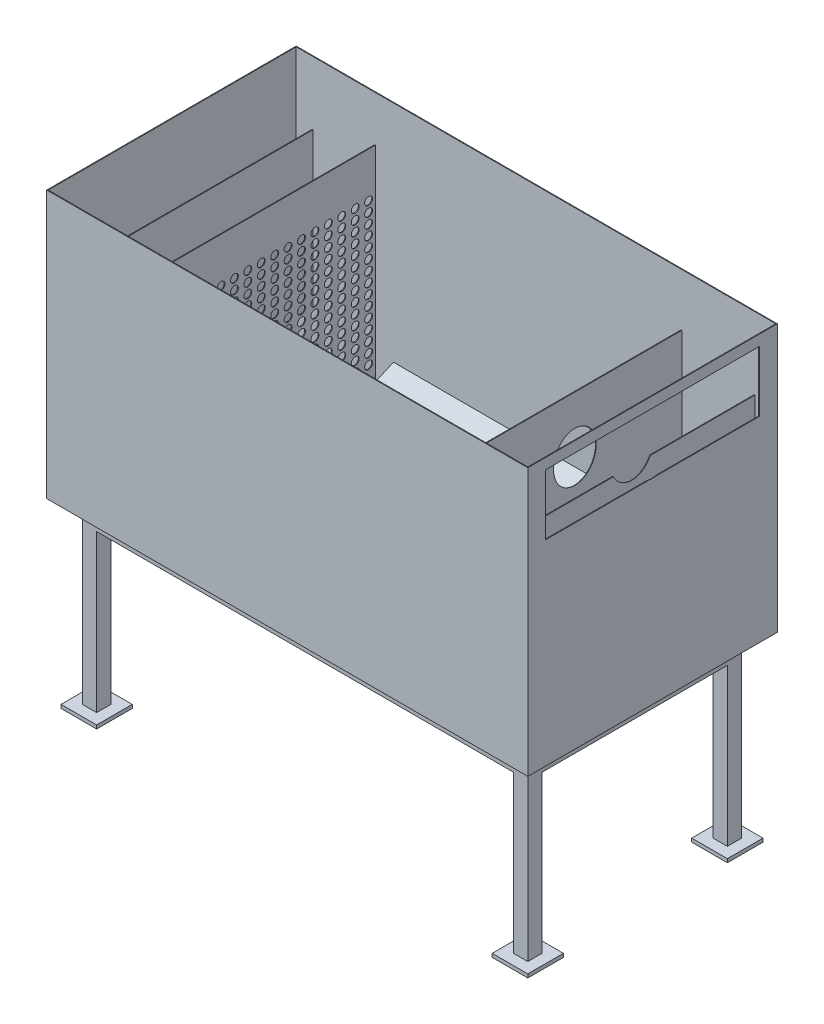
from build123d import *

# Parameters (mm, degrees)
MASTER_FOOTPRINT_W                  = 1350
MASTER_FOOTPRINT_H                  = 700
BATH_BASE_PLATE_DEPTH               = 750
BATH_SHELL_2MM_T                    = -2
SKETCH_1_R                          = 50
INLET_D100_OPENING_DEPTH            = 10
INLET_IMPACT_BAFFLE_START           = 125
SKETCH_2_W                          = 540
SKETCH_2_H                          = 430
INLET_IMPACT_BAFFLE_DEPTH           = 2
DISTRIBUTOR_D22_START               = 250
SKETCH_3_W                          = 640
SKETCH_3_H                          = 648
SKETCH_3_R                          = 11
DISTRIBUTOR_D22_DEPTH               = 2
OUTLET_SUBMERGED_BAFFLE_START       = 1130
SKETCH_4_W                          = 600
SKETCH_4_H                          = 330
OUTLET_SUBMERGED_BAFFLE_DEPTH       = 2
OVERFLOW_WEIR_Z550_START            = 1290
SKETCH_5_W                          = 690
SKETCH_5_H                          = 548
OVERFLOW_WEIR_Z550_DEPTH            = 2
OUTLET_WEIR_SLOT_W600_START         = 1345
SKETCH_6_W                          = 600
SKETCH_6_H                          = 170
OUTLET_WEIR_SLOT_W600_DEPTH         = 10
SLOPED_SEDIMENT_FLOOR_START         = 275
SLOPED_SEDIMENT_FLOOR_DEPTH         = 825
SKETCH_8_W                          = 40
SKETCH_8_H                          = 40
FRAME_LEGS_40X40_H500_DEPTH         = 500
FRAME_LONGITUDINAL_RAILS_START      = -20
SKETCH_9_W                          = 1250
SKETCH_9_H                          = 40
FRAME_LONGITUDINAL_RAILS_DEPTH      = 40
FRAME_TRANSVERSE_RAILS_START        = -20
SKETCH_10_W                         = 40
SKETCH_10_H                         = 520
FRAME_TRANSVERSE_RAILS_DEPTH        = 40
FRAME_FOOT_PADS_100X100_START       = -500
SKETCH_11_W                         = 100
SKETCH_11_H                         = 100
FRAME_FOOT_PADS_100X100_DEPTH       = 10
SEALED_SCREW_PASSAGE_D120_PROFILE_R = 60


with BuildPart() as part:
    # MASTER_FOOTPRINT → BATH_BASE_PLATE (new body)
    with BuildSketch(Plane(origin=(0, 0, 0), x_dir=(1, 0, 0), z_dir=(0, 1, 0))):
        with Locations((675, 350)):
            Rectangle(MASTER_FOOTPRINT_W, MASTER_FOOTPRINT_H)
    extrude(amount=BATH_BASE_PLATE_DEPTH)

    # BATH_SHELL_2MM
    bath_shell_2mm_openings = [part.faces().sort_by_distance(p)[0] for p in [
        (675, 750, -350),
    ]]
    offset(amount=BATH_SHELL_2MM_T, openings=bath_shell_2mm_openings, kind=Kind.INTERSECTION)

    # Эскиз1 → INLET_D100_OPENING (cut)
    with BuildSketch(Plane(origin=(0, 0, 0), x_dir=(0, 0, -1), z_dir=(1, 0, 0))):
        with Locations((350, 420)):
            Circle(SKETCH_1_R)
    extrude(amount=INLET_D100_OPENING_DEPTH, mode=Mode.SUBTRACT)

    # Эскиз6 → OUTLET_WEIR_SLOT_W600 (cut)
    with BuildSketch(Plane(origin=(0, 0, 0), x_dir=(0, 0, -1), z_dir=(1, 0, 0)).offset(OUTLET_WEIR_SLOT_W600_START)):
        with Locations((350, 635)):
            Rectangle(SKETCH_6_W, SKETCH_6_H)
    extrude(amount=OUTLET_WEIR_SLOT_W600_DEPTH, mode=Mode.SUBTRACT)

    # Эскиз7 → SLOPED_SEDIMENT_FLOOR (add)
    with BuildSketch(Plane(origin=(0, 0, 0), x_dir=(0, 0, -1), z_dir=(1, 0, 0)).offset(SLOPED_SEDIMENT_FLOOR_START)):
        Polygon((2, -1), (2, 120), (280, -1), align=None)
        Polygon((698, -1), (698, 120), (420, -1), align=None)
    extrude(amount=SLOPED_SEDIMENT_FLOOR_DEPTH)

    # Эскиз8 → FRAME_LEGS_40X40_H500 (add)
    with BuildSketch(Plane(origin=(0, 0, 0), x_dir=(1, 0, 0), z_dir=(0, 1, 0))):
        with Locations((70, 70)):
            Rectangle(SKETCH_8_W, SKETCH_8_H)
        with Locations((70, 630)):
            Rectangle(SKETCH_8_W, SKETCH_8_H)
        with Locations((1280, 70)):
            Rectangle(SKETCH_8_W, SKETCH_8_H)
        with Locations((1280, 630)):
            Rectangle(SKETCH_8_W, SKETCH_8_H)
    extrude(amount=-FRAME_LEGS_40X40_H500_DEPTH)

    # Эскиз9 → FRAME_LONGITUDINAL_RAILS (add)
    with BuildSketch(Plane(origin=(0, 0, 0), x_dir=(1, 0, 0), z_dir=(0, 1, 0)).offset(FRAME_LONGITUDINAL_RAILS_START)):
        with Locations((675, 70)):
            Rectangle(SKETCH_9_W, SKETCH_9_H)
        with Locations((675, 630)):
            Rectangle(SKETCH_9_W, SKETCH_9_H)
    extrude(amount=-FRAME_LONGITUDINAL_RAILS_DEPTH)

    # Эскиз10 → FRAME_TRANSVERSE_RAILS (add)
    with BuildSketch(Plane(origin=(0, 0, 0), x_dir=(1, 0, 0), z_dir=(0, 1, 0)).offset(FRAME_TRANSVERSE_RAILS_START)):
        with Locations((70, 350)):
            Rectangle(SKETCH_10_W, SKETCH_10_H)
        with Locations((1280, 350)):
            Rectangle(SKETCH_10_W, SKETCH_10_H)
    extrude(amount=-FRAME_TRANSVERSE_RAILS_DEPTH)

    # Эскиз11 → FRAME_FOOT_PADS_100X100 (add)
    with BuildSketch(Plane(origin=(0, 0, 0), x_dir=(1, 0, 0), z_dir=(0, 1, 0)).offset(FRAME_FOOT_PADS_100X100_START)):
        with Locations((70, 70)):
            Rectangle(SKETCH_11_W, SKETCH_11_H)
        with Locations((70, 630)):
            Rectangle(SKETCH_11_W, SKETCH_11_H)
        with Locations((1280, 70)):
            Rectangle(SKETCH_11_W, SKETCH_11_H)
        with Locations((1280, 630)):
            Rectangle(SKETCH_11_W, SKETCH_11_H)
    extrude(amount=-FRAME_FOOT_PADS_100X100_DEPTH)


with BuildPart() as body_2:
    # Эскиз2 → INLET_IMPACT_BAFFLE (new body)
    with BuildSketch(Plane(origin=(0, 0, 0), x_dir=(0, 0, -1), z_dir=(1, 0, 0)).offset(INLET_IMPACT_BAFFLE_START)):
        with Locations((350, 435)):
            Rectangle(SKETCH_2_W, SKETCH_2_H)
    extrude(amount=INLET_IMPACT_BAFFLE_DEPTH)


with BuildPart() as body_3:
    # Эскиз3 → DISTRIBUTOR_D22 (new body)
    with BuildSketch(Plane(origin=(0, 0, 0), x_dir=(0, 0, -1), z_dir=(1, 0, 0)).offset(DISTRIBUTOR_D22_START)):
        with Locations((350, 326)):
            Rectangle(SKETCH_3_W, SKETCH_3_H)
        with Locations((48.823529412, 125)):
            Circle(SKETCH_3_R, mode=Mode.SUBTRACT)
        with Locations((48.823529412, 153.5)):
            Circle(SKETCH_3_R, mode=Mode.SUBTRACT)
        with Locations((48.823529412, 182)):
            Circle(SKETCH_3_R, mode=Mode.SUBTRACT)
        with Locations((48.823529412, 210.5)):
            Circle(SKETCH_3_R, mode=Mode.SUBTRACT)
        with Locations((48.823529412, 239)):
            Circle(SKETCH_3_R, mode=Mode.SUBTRACT)
        with Locations((48.823529412, 267.5)):
            Circle(SKETCH_3_R, mode=Mode.SUBTRACT)
        with Locations((48.823529412, 296)):
            Circle(SKETCH_3_R, mode=Mode.SUBTRACT)
        with Locations((48.823529412, 324.5)):
            Circle(SKETCH_3_R, mode=Mode.SUBTRACT)
        with Locations((48.823529412, 353)):
            Circle(SKETCH_3_R, mode=Mode.SUBTRACT)
        with Locations((48.823529412, 381.5)):
            Circle(SKETCH_3_R, mode=Mode.SUBTRACT)
        with Locations((48.823529412, 410)):
            Circle(SKETCH_3_R, mode=Mode.SUBTRACT)
        with Locations((48.823529412, 438.5)):
            Circle(SKETCH_3_R, mode=Mode.SUBTRACT)
        with Locations((48.823529412, 467)):
            Circle(SKETCH_3_R, mode=Mode.SUBTRACT)
        with Locations((48.823529412, 495.5)):
            Circle(SKETCH_3_R, mode=Mode.SUBTRACT)
        with Locations((48.823529412, 524)):
            Circle(SKETCH_3_R, mode=Mode.SUBTRACT)
        with Locations((86.470588235, 125)):
            Circle(SKETCH_3_R, mode=Mode.SUBTRACT)
        with Locations((86.470588235, 153.5)):
            Circle(SKETCH_3_R, mode=Mode.SUBTRACT)
        with Locations((86.470588235, 182)):
            Circle(SKETCH_3_R, mode=Mode.SUBTRACT)
        with Locations((86.470588235, 210.5)):
            Circle(SKETCH_3_R, mode=Mode.SUBTRACT)
        with Locations((86.470588235, 239)):
            Circle(SKETCH_3_R, mode=Mode.SUBTRACT)
        with Locations((86.470588235, 267.5)):
            Circle(SKETCH_3_R, mode=Mode.SUBTRACT)
        with Locations((86.470588235, 296)):
            Circle(SKETCH_3_R, mode=Mode.SUBTRACT)
        with Locations((86.470588235, 324.5)):
            Circle(SKETCH_3_R, mode=Mode.SUBTRACT)
        with Locations((86.470588235, 353)):
            Circle(SKETCH_3_R, mode=Mode.SUBTRACT)
        with Locations((86.470588235, 381.5)):
            Circle(SKETCH_3_R, mode=Mode.SUBTRACT)
        with Locations((86.470588235, 410)):
            Circle(SKETCH_3_R, mode=Mode.SUBTRACT)
        with Locations((86.470588235, 438.5)):
            Circle(SKETCH_3_R, mode=Mode.SUBTRACT)
        with Locations((86.470588235, 467)):
            Circle(SKETCH_3_R, mode=Mode.SUBTRACT)
        with Locations((86.470588235, 495.5)):
            Circle(SKETCH_3_R, mode=Mode.SUBTRACT)
        with Locations((86.470588235, 524)):
            Circle(SKETCH_3_R, mode=Mode.SUBTRACT)
        with Locations((124.117647059, 125)):
            Circle(SKETCH_3_R, mode=Mode.SUBTRACT)
        with Locations((124.117647059, 153.5)):
            Circle(SKETCH_3_R, mode=Mode.SUBTRACT)
        with Locations((124.117647059, 182)):
            Circle(SKETCH_3_R, mode=Mode.SUBTRACT)
        with Locations((124.117647059, 210.5)):
            Circle(SKETCH_3_R, mode=Mode.SUBTRACT)
        with Locations((124.117647059, 239)):
            Circle(SKETCH_3_R, mode=Mode.SUBTRACT)
        with Locations((124.117647059, 267.5)):
            Circle(SKETCH_3_R, mode=Mode.SUBTRACT)
        with Locations((124.117647059, 296)):
            Circle(SKETCH_3_R, mode=Mode.SUBTRACT)
        with Locations((124.117647059, 324.5)):
            Circle(SKETCH_3_R, mode=Mode.SUBTRACT)
        with Locations((124.117647059, 353)):
            Circle(SKETCH_3_R, mode=Mode.SUBTRACT)
        with Locations((124.117647059, 381.5)):
            Circle(SKETCH_3_R, mode=Mode.SUBTRACT)
        with Locations((124.117647059, 410)):
            Circle(SKETCH_3_R, mode=Mode.SUBTRACT)
        with Locations((124.117647059, 438.5)):
            Circle(SKETCH_3_R, mode=Mode.SUBTRACT)
        with Locations((124.117647059, 467)):
            Circle(SKETCH_3_R, mode=Mode.SUBTRACT)
        with Locations((124.117647059, 495.5)):
            Circle(SKETCH_3_R, mode=Mode.SUBTRACT)
        with Locations((124.117647059, 524)):
            Circle(SKETCH_3_R, mode=Mode.SUBTRACT)
        with Locations((161.764705882, 125)):
            Circle(SKETCH_3_R, mode=Mode.SUBTRACT)
        with Locations((161.764705882, 153.5)):
            Circle(SKETCH_3_R, mode=Mode.SUBTRACT)
        with Locations((161.764705882, 182)):
            Circle(SKETCH_3_R, mode=Mode.SUBTRACT)
        with Locations((161.764705882, 210.5)):
            Circle(SKETCH_3_R, mode=Mode.SUBTRACT)
        with Locations((161.764705882, 239)):
            Circle(SKETCH_3_R, mode=Mode.SUBTRACT)
        with Locations((161.764705882, 267.5)):
            Circle(SKETCH_3_R, mode=Mode.SUBTRACT)
        with Locations((161.764705882, 296)):
            Circle(SKETCH_3_R, mode=Mode.SUBTRACT)
        with Locations((161.764705882, 324.5)):
            Circle(SKETCH_3_R, mode=Mode.SUBTRACT)
        with Locations((161.764705882, 353)):
            Circle(SKETCH_3_R, mode=Mode.SUBTRACT)
        with Locations((161.764705882, 381.5)):
            Circle(SKETCH_3_R, mode=Mode.SUBTRACT)
        with Locations((161.764705882, 410)):
            Circle(SKETCH_3_R, mode=Mode.SUBTRACT)
        with Locations((161.764705882, 438.5)):
            Circle(SKETCH_3_R, mode=Mode.SUBTRACT)
        with Locations((161.764705882, 467)):
            Circle(SKETCH_3_R, mode=Mode.SUBTRACT)
        with Locations((161.764705882, 495.5)):
            Circle(SKETCH_3_R, mode=Mode.SUBTRACT)
        with Locations((161.764705882, 524)):
            Circle(SKETCH_3_R, mode=Mode.SUBTRACT)
        with Locations((199.411764706, 125)):
            Circle(SKETCH_3_R, mode=Mode.SUBTRACT)
        with Locations((199.411764706, 153.5)):
            Circle(SKETCH_3_R, mode=Mode.SUBTRACT)
        with Locations((199.411764706, 182)):
            Circle(SKETCH_3_R, mode=Mode.SUBTRACT)
        with Locations((199.411764706, 210.5)):
            Circle(SKETCH_3_R, mode=Mode.SUBTRACT)
        with Locations((199.411764706, 239)):
            Circle(SKETCH_3_R, mode=Mode.SUBTRACT)
        with Locations((199.411764706, 267.5)):
            Circle(SKETCH_3_R, mode=Mode.SUBTRACT)
        with Locations((199.411764706, 296)):
            Circle(SKETCH_3_R, mode=Mode.SUBTRACT)
        with Locations((199.411764706, 324.5)):
            Circle(SKETCH_3_R, mode=Mode.SUBTRACT)
        with Locations((199.411764706, 353)):
            Circle(SKETCH_3_R, mode=Mode.SUBTRACT)
        with Locations((199.411764706, 381.5)):
            Circle(SKETCH_3_R, mode=Mode.SUBTRACT)
        with Locations((199.411764706, 410)):
            Circle(SKETCH_3_R, mode=Mode.SUBTRACT)
        with Locations((199.411764706, 438.5)):
            Circle(SKETCH_3_R, mode=Mode.SUBTRACT)
        with Locations((199.411764706, 467)):
            Circle(SKETCH_3_R, mode=Mode.SUBTRACT)
        with Locations((199.411764706, 495.5)):
            Circle(SKETCH_3_R, mode=Mode.SUBTRACT)
        with Locations((199.411764706, 524)):
            Circle(SKETCH_3_R, mode=Mode.SUBTRACT)
        with Locations((237.058823529, 125)):
            Circle(SKETCH_3_R, mode=Mode.SUBTRACT)
        with Locations((237.058823529, 153.5)):
            Circle(SKETCH_3_R, mode=Mode.SUBTRACT)
        with Locations((237.058823529, 182)):
            Circle(SKETCH_3_R, mode=Mode.SUBTRACT)
        with Locations((237.058823529, 210.5)):
            Circle(SKETCH_3_R, mode=Mode.SUBTRACT)
        with Locations((237.058823529, 239)):
            Circle(SKETCH_3_R, mode=Mode.SUBTRACT)
        with Locations((237.058823529, 267.5)):
            Circle(SKETCH_3_R, mode=Mode.SUBTRACT)
        with Locations((237.058823529, 296)):
            Circle(SKETCH_3_R, mode=Mode.SUBTRACT)
        with Locations((237.058823529, 324.5)):
            Circle(SKETCH_3_R, mode=Mode.SUBTRACT)
        with Locations((237.058823529, 353)):
            Circle(SKETCH_3_R, mode=Mode.SUBTRACT)
        with Locations((237.058823529, 381.5)):
            Circle(SKETCH_3_R, mode=Mode.SUBTRACT)
        with Locations((237.058823529, 410)):
            Circle(SKETCH_3_R, mode=Mode.SUBTRACT)
        with Locations((237.058823529, 438.5)):
            Circle(SKETCH_3_R, mode=Mode.SUBTRACT)
        with Locations((237.058823529, 467)):
            Circle(SKETCH_3_R, mode=Mode.SUBTRACT)
        with Locations((237.058823529, 495.5)):
            Circle(SKETCH_3_R, mode=Mode.SUBTRACT)
        with Locations((237.058823529, 524)):
            Circle(SKETCH_3_R, mode=Mode.SUBTRACT)
        with Locations((274.705882353, 125)):
            Circle(SKETCH_3_R, mode=Mode.SUBTRACT)
        with Locations((274.705882353, 153.5)):
            Circle(SKETCH_3_R, mode=Mode.SUBTRACT)
        with Locations((274.705882353, 182)):
            Circle(SKETCH_3_R, mode=Mode.SUBTRACT)
        with Locations((274.705882353, 210.5)):
            Circle(SKETCH_3_R, mode=Mode.SUBTRACT)
        with Locations((274.705882353, 239)):
            Circle(SKETCH_3_R, mode=Mode.SUBTRACT)
        with Locations((274.705882353, 267.5)):
            Circle(SKETCH_3_R, mode=Mode.SUBTRACT)
        with Locations((274.705882353, 296)):
            Circle(SKETCH_3_R, mode=Mode.SUBTRACT)
        with Locations((274.705882353, 324.5)):
            Circle(SKETCH_3_R, mode=Mode.SUBTRACT)
        with Locations((274.705882353, 353)):
            Circle(SKETCH_3_R, mode=Mode.SUBTRACT)
        with Locations((274.705882353, 381.5)):
            Circle(SKETCH_3_R, mode=Mode.SUBTRACT)
        with Locations((274.705882353, 410)):
            Circle(SKETCH_3_R, mode=Mode.SUBTRACT)
        with Locations((274.705882353, 438.5)):
            Circle(SKETCH_3_R, mode=Mode.SUBTRACT)
        with Locations((274.705882353, 467)):
            Circle(SKETCH_3_R, mode=Mode.SUBTRACT)
        with Locations((274.705882353, 495.5)):
            Circle(SKETCH_3_R, mode=Mode.SUBTRACT)
        with Locations((274.705882353, 524)):
            Circle(SKETCH_3_R, mode=Mode.SUBTRACT)
        with Locations((312.352941176, 125)):
            Circle(SKETCH_3_R, mode=Mode.SUBTRACT)
        with Locations((312.352941176, 153.5)):
            Circle(SKETCH_3_R, mode=Mode.SUBTRACT)
        with Locations((312.352941176, 182)):
            Circle(SKETCH_3_R, mode=Mode.SUBTRACT)
        with Locations((312.352941176, 210.5)):
            Circle(SKETCH_3_R, mode=Mode.SUBTRACT)
        with Locations((312.352941176, 239)):
            Circle(SKETCH_3_R, mode=Mode.SUBTRACT)
        with Locations((312.352941176, 267.5)):
            Circle(SKETCH_3_R, mode=Mode.SUBTRACT)
        with Locations((312.352941176, 296)):
            Circle(SKETCH_3_R, mode=Mode.SUBTRACT)
        with Locations((312.352941176, 324.5)):
            Circle(SKETCH_3_R, mode=Mode.SUBTRACT)
        with Locations((312.352941176, 353)):
            Circle(SKETCH_3_R, mode=Mode.SUBTRACT)
        with Locations((312.352941176, 381.5)):
            Circle(SKETCH_3_R, mode=Mode.SUBTRACT)
        with Locations((312.352941176, 410)):
            Circle(SKETCH_3_R, mode=Mode.SUBTRACT)
        with Locations((312.352941176, 438.5)):
            Circle(SKETCH_3_R, mode=Mode.SUBTRACT)
        with Locations((312.352941176, 467)):
            Circle(SKETCH_3_R, mode=Mode.SUBTRACT)
        with Locations((312.352941176, 495.5)):
            Circle(SKETCH_3_R, mode=Mode.SUBTRACT)
        with Locations((312.352941176, 524)):
            Circle(SKETCH_3_R, mode=Mode.SUBTRACT)
        with Locations((350, 125)):
            Circle(SKETCH_3_R, mode=Mode.SUBTRACT)
        with Locations((350, 153.5)):
            Circle(SKETCH_3_R, mode=Mode.SUBTRACT)
        with Locations((350, 182)):
            Circle(SKETCH_3_R, mode=Mode.SUBTRACT)
        with Locations((350, 210.5)):
            Circle(SKETCH_3_R, mode=Mode.SUBTRACT)
        with Locations((350, 239)):
            Circle(SKETCH_3_R, mode=Mode.SUBTRACT)
        with Locations((350, 267.5)):
            Circle(SKETCH_3_R, mode=Mode.SUBTRACT)
        with Locations((350, 296)):
            Circle(SKETCH_3_R, mode=Mode.SUBTRACT)
        with Locations((350, 324.5)):
            Circle(SKETCH_3_R, mode=Mode.SUBTRACT)
        with Locations((350, 353)):
            Circle(SKETCH_3_R, mode=Mode.SUBTRACT)
        with Locations((350, 381.5)):
            Circle(SKETCH_3_R, mode=Mode.SUBTRACT)
        with Locations((350, 410)):
            Circle(SKETCH_3_R, mode=Mode.SUBTRACT)
        with Locations((350, 438.5)):
            Circle(SKETCH_3_R, mode=Mode.SUBTRACT)
        with Locations((350, 467)):
            Circle(SKETCH_3_R, mode=Mode.SUBTRACT)
        with Locations((350, 495.5)):
            Circle(SKETCH_3_R, mode=Mode.SUBTRACT)
        with Locations((350, 524)):
            Circle(SKETCH_3_R, mode=Mode.SUBTRACT)
        with Locations((387.647058824, 125)):
            Circle(SKETCH_3_R, mode=Mode.SUBTRACT)
        with Locations((387.647058824, 153.5)):
            Circle(SKETCH_3_R, mode=Mode.SUBTRACT)
        with Locations((387.647058824, 182)):
            Circle(SKETCH_3_R, mode=Mode.SUBTRACT)
        with Locations((387.647058824, 210.5)):
            Circle(SKETCH_3_R, mode=Mode.SUBTRACT)
        with Locations((387.647058824, 239)):
            Circle(SKETCH_3_R, mode=Mode.SUBTRACT)
        with Locations((387.647058824, 267.5)):
            Circle(SKETCH_3_R, mode=Mode.SUBTRACT)
        with Locations((387.647058824, 296)):
            Circle(SKETCH_3_R, mode=Mode.SUBTRACT)
        with Locations((387.647058824, 324.5)):
            Circle(SKETCH_3_R, mode=Mode.SUBTRACT)
        with Locations((387.647058824, 353)):
            Circle(SKETCH_3_R, mode=Mode.SUBTRACT)
        with Locations((387.647058824, 381.5)):
            Circle(SKETCH_3_R, mode=Mode.SUBTRACT)
        with Locations((387.647058824, 410)):
            Circle(SKETCH_3_R, mode=Mode.SUBTRACT)
        with Locations((387.647058824, 438.5)):
            Circle(SKETCH_3_R, mode=Mode.SUBTRACT)
        with Locations((387.647058824, 467)):
            Circle(SKETCH_3_R, mode=Mode.SUBTRACT)
        with Locations((387.647058824, 495.5)):
            Circle(SKETCH_3_R, mode=Mode.SUBTRACT)
        with Locations((387.647058824, 524)):
            Circle(SKETCH_3_R, mode=Mode.SUBTRACT)
        with Locations((425.294117647, 125)):
            Circle(SKETCH_3_R, mode=Mode.SUBTRACT)
        with Locations((425.294117647, 153.5)):
            Circle(SKETCH_3_R, mode=Mode.SUBTRACT)
        with Locations((425.294117647, 182)):
            Circle(SKETCH_3_R, mode=Mode.SUBTRACT)
        with Locations((425.294117647, 210.5)):
            Circle(SKETCH_3_R, mode=Mode.SUBTRACT)
        with Locations((425.294117647, 239)):
            Circle(SKETCH_3_R, mode=Mode.SUBTRACT)
        with Locations((425.294117647, 267.5)):
            Circle(SKETCH_3_R, mode=Mode.SUBTRACT)
        with Locations((425.294117647, 296)):
            Circle(SKETCH_3_R, mode=Mode.SUBTRACT)
        with Locations((425.294117647, 324.5)):
            Circle(SKETCH_3_R, mode=Mode.SUBTRACT)
        with Locations((425.294117647, 353)):
            Circle(SKETCH_3_R, mode=Mode.SUBTRACT)
        with Locations((425.294117647, 381.5)):
            Circle(SKETCH_3_R, mode=Mode.SUBTRACT)
        with Locations((425.294117647, 410)):
            Circle(SKETCH_3_R, mode=Mode.SUBTRACT)
        with Locations((425.294117647, 438.5)):
            Circle(SKETCH_3_R, mode=Mode.SUBTRACT)
        with Locations((425.294117647, 467)):
            Circle(SKETCH_3_R, mode=Mode.SUBTRACT)
        with Locations((425.294117647, 495.5)):
            Circle(SKETCH_3_R, mode=Mode.SUBTRACT)
        with Locations((425.294117647, 524)):
            Circle(SKETCH_3_R, mode=Mode.SUBTRACT)
        with Locations((462.941176471, 125)):
            Circle(SKETCH_3_R, mode=Mode.SUBTRACT)
        with Locations((462.941176471, 153.5)):
            Circle(SKETCH_3_R, mode=Mode.SUBTRACT)
        with Locations((462.941176471, 182)):
            Circle(SKETCH_3_R, mode=Mode.SUBTRACT)
        with Locations((462.941176471, 210.5)):
            Circle(SKETCH_3_R, mode=Mode.SUBTRACT)
        with Locations((462.941176471, 239)):
            Circle(SKETCH_3_R, mode=Mode.SUBTRACT)
        with Locations((462.941176471, 267.5)):
            Circle(SKETCH_3_R, mode=Mode.SUBTRACT)
        with Locations((462.941176471, 296)):
            Circle(SKETCH_3_R, mode=Mode.SUBTRACT)
        with Locations((462.941176471, 324.5)):
            Circle(SKETCH_3_R, mode=Mode.SUBTRACT)
        with Locations((462.941176471, 353)):
            Circle(SKETCH_3_R, mode=Mode.SUBTRACT)
        with Locations((462.941176471, 381.5)):
            Circle(SKETCH_3_R, mode=Mode.SUBTRACT)
        with Locations((462.941176471, 410)):
            Circle(SKETCH_3_R, mode=Mode.SUBTRACT)
        with Locations((462.941176471, 438.5)):
            Circle(SKETCH_3_R, mode=Mode.SUBTRACT)
        with Locations((462.941176471, 467)):
            Circle(SKETCH_3_R, mode=Mode.SUBTRACT)
        with Locations((462.941176471, 495.5)):
            Circle(SKETCH_3_R, mode=Mode.SUBTRACT)
        with Locations((462.941176471, 524)):
            Circle(SKETCH_3_R, mode=Mode.SUBTRACT)
        with Locations((500.588235294, 125)):
            Circle(SKETCH_3_R, mode=Mode.SUBTRACT)
        with Locations((500.588235294, 153.5)):
            Circle(SKETCH_3_R, mode=Mode.SUBTRACT)
        with Locations((500.588235294, 182)):
            Circle(SKETCH_3_R, mode=Mode.SUBTRACT)
        with Locations((500.588235294, 210.5)):
            Circle(SKETCH_3_R, mode=Mode.SUBTRACT)
        with Locations((500.588235294, 239)):
            Circle(SKETCH_3_R, mode=Mode.SUBTRACT)
        with Locations((500.588235294, 267.5)):
            Circle(SKETCH_3_R, mode=Mode.SUBTRACT)
        with Locations((500.588235294, 296)):
            Circle(SKETCH_3_R, mode=Mode.SUBTRACT)
        with Locations((500.588235294, 324.5)):
            Circle(SKETCH_3_R, mode=Mode.SUBTRACT)
        with Locations((500.588235294, 353)):
            Circle(SKETCH_3_R, mode=Mode.SUBTRACT)
        with Locations((500.588235294, 381.5)):
            Circle(SKETCH_3_R, mode=Mode.SUBTRACT)
        with Locations((500.588235294, 410)):
            Circle(SKETCH_3_R, mode=Mode.SUBTRACT)
        with Locations((500.588235294, 438.5)):
            Circle(SKETCH_3_R, mode=Mode.SUBTRACT)
        with Locations((500.588235294, 467)):
            Circle(SKETCH_3_R, mode=Mode.SUBTRACT)
        with Locations((500.588235294, 495.5)):
            Circle(SKETCH_3_R, mode=Mode.SUBTRACT)
        with Locations((500.588235294, 524)):
            Circle(SKETCH_3_R, mode=Mode.SUBTRACT)
        with Locations((538.235294118, 125)):
            Circle(SKETCH_3_R, mode=Mode.SUBTRACT)
        with Locations((538.235294118, 153.5)):
            Circle(SKETCH_3_R, mode=Mode.SUBTRACT)
        with Locations((538.235294118, 182)):
            Circle(SKETCH_3_R, mode=Mode.SUBTRACT)
        with Locations((538.235294118, 210.5)):
            Circle(SKETCH_3_R, mode=Mode.SUBTRACT)
        with Locations((538.235294118, 239)):
            Circle(SKETCH_3_R, mode=Mode.SUBTRACT)
        with Locations((538.235294118, 267.5)):
            Circle(SKETCH_3_R, mode=Mode.SUBTRACT)
        with Locations((538.235294118, 296)):
            Circle(SKETCH_3_R, mode=Mode.SUBTRACT)
        with Locations((538.235294118, 324.5)):
            Circle(SKETCH_3_R, mode=Mode.SUBTRACT)
        with Locations((538.235294118, 353)):
            Circle(SKETCH_3_R, mode=Mode.SUBTRACT)
        with Locations((538.235294118, 381.5)):
            Circle(SKETCH_3_R, mode=Mode.SUBTRACT)
        with Locations((538.235294118, 410)):
            Circle(SKETCH_3_R, mode=Mode.SUBTRACT)
        with Locations((538.235294118, 438.5)):
            Circle(SKETCH_3_R, mode=Mode.SUBTRACT)
        with Locations((538.235294118, 467)):
            Circle(SKETCH_3_R, mode=Mode.SUBTRACT)
        with Locations((538.235294118, 495.5)):
            Circle(SKETCH_3_R, mode=Mode.SUBTRACT)
        with Locations((538.235294118, 524)):
            Circle(SKETCH_3_R, mode=Mode.SUBTRACT)
        with Locations((575.882352941, 125)):
            Circle(SKETCH_3_R, mode=Mode.SUBTRACT)
        with Locations((575.882352941, 153.5)):
            Circle(SKETCH_3_R, mode=Mode.SUBTRACT)
        with Locations((575.882352941, 182)):
            Circle(SKETCH_3_R, mode=Mode.SUBTRACT)
        with Locations((575.882352941, 210.5)):
            Circle(SKETCH_3_R, mode=Mode.SUBTRACT)
        with Locations((575.882352941, 239)):
            Circle(SKETCH_3_R, mode=Mode.SUBTRACT)
        with Locations((575.882352941, 267.5)):
            Circle(SKETCH_3_R, mode=Mode.SUBTRACT)
        with Locations((575.882352941, 296)):
            Circle(SKETCH_3_R, mode=Mode.SUBTRACT)
        with Locations((575.882352941, 324.5)):
            Circle(SKETCH_3_R, mode=Mode.SUBTRACT)
        with Locations((575.882352941, 353)):
            Circle(SKETCH_3_R, mode=Mode.SUBTRACT)
        with Locations((575.882352941, 381.5)):
            Circle(SKETCH_3_R, mode=Mode.SUBTRACT)
        with Locations((575.882352941, 410)):
            Circle(SKETCH_3_R, mode=Mode.SUBTRACT)
        with Locations((575.882352941, 438.5)):
            Circle(SKETCH_3_R, mode=Mode.SUBTRACT)
        with Locations((575.882352941, 467)):
            Circle(SKETCH_3_R, mode=Mode.SUBTRACT)
        with Locations((575.882352941, 495.5)):
            Circle(SKETCH_3_R, mode=Mode.SUBTRACT)
        with Locations((575.882352941, 524)):
            Circle(SKETCH_3_R, mode=Mode.SUBTRACT)
        with Locations((613.529411765, 125)):
            Circle(SKETCH_3_R, mode=Mode.SUBTRACT)
        with Locations((613.529411765, 153.5)):
            Circle(SKETCH_3_R, mode=Mode.SUBTRACT)
        with Locations((613.529411765, 182)):
            Circle(SKETCH_3_R, mode=Mode.SUBTRACT)
        with Locations((613.529411765, 210.5)):
            Circle(SKETCH_3_R, mode=Mode.SUBTRACT)
        with Locations((613.529411765, 239)):
            Circle(SKETCH_3_R, mode=Mode.SUBTRACT)
        with Locations((613.529411765, 267.5)):
            Circle(SKETCH_3_R, mode=Mode.SUBTRACT)
        with Locations((613.529411765, 296)):
            Circle(SKETCH_3_R, mode=Mode.SUBTRACT)
        with Locations((613.529411765, 324.5)):
            Circle(SKETCH_3_R, mode=Mode.SUBTRACT)
        with Locations((613.529411765, 353)):
            Circle(SKETCH_3_R, mode=Mode.SUBTRACT)
        with Locations((613.529411765, 381.5)):
            Circle(SKETCH_3_R, mode=Mode.SUBTRACT)
        with Locations((613.529411765, 410)):
            Circle(SKETCH_3_R, mode=Mode.SUBTRACT)
        with Locations((613.529411765, 438.5)):
            Circle(SKETCH_3_R, mode=Mode.SUBTRACT)
        with Locations((613.529411765, 467)):
            Circle(SKETCH_3_R, mode=Mode.SUBTRACT)
        with Locations((613.529411765, 495.5)):
            Circle(SKETCH_3_R, mode=Mode.SUBTRACT)
        with Locations((613.529411765, 524)):
            Circle(SKETCH_3_R, mode=Mode.SUBTRACT)
        with Locations((651.176470588, 125)):
            Circle(SKETCH_3_R, mode=Mode.SUBTRACT)
        with Locations((651.176470588, 153.5)):
            Circle(SKETCH_3_R, mode=Mode.SUBTRACT)
        with Locations((651.176470588, 182)):
            Circle(SKETCH_3_R, mode=Mode.SUBTRACT)
        with Locations((651.176470588, 210.5)):
            Circle(SKETCH_3_R, mode=Mode.SUBTRACT)
        with Locations((651.176470588, 239)):
            Circle(SKETCH_3_R, mode=Mode.SUBTRACT)
        with Locations((651.176470588, 267.5)):
            Circle(SKETCH_3_R, mode=Mode.SUBTRACT)
        with Locations((651.176470588, 296)):
            Circle(SKETCH_3_R, mode=Mode.SUBTRACT)
        with Locations((651.176470588, 324.5)):
            Circle(SKETCH_3_R, mode=Mode.SUBTRACT)
        with Locations((651.176470588, 353)):
            Circle(SKETCH_3_R, mode=Mode.SUBTRACT)
        with Locations((651.176470588, 381.5)):
            Circle(SKETCH_3_R, mode=Mode.SUBTRACT)
        with Locations((651.176470588, 410)):
            Circle(SKETCH_3_R, mode=Mode.SUBTRACT)
        with Locations((651.176470588, 438.5)):
            Circle(SKETCH_3_R, mode=Mode.SUBTRACT)
        with Locations((651.176470588, 467)):
            Circle(SKETCH_3_R, mode=Mode.SUBTRACT)
        with Locations((651.176470588, 495.5)):
            Circle(SKETCH_3_R, mode=Mode.SUBTRACT)
        with Locations((651.176470588, 524)):
            Circle(SKETCH_3_R, mode=Mode.SUBTRACT)
    extrude(amount=DISTRIBUTOR_D22_DEPTH)


with BuildPart() as body_4:
    # Эскиз4 → OUTLET_SUBMERGED_BAFFLE (new body)
    with BuildSketch(Plane(origin=(0, 0, 0), x_dir=(0, 0, -1), z_dir=(1, 0, 0)).offset(OUTLET_SUBMERGED_BAFFLE_START)):
        with Locations((350, 485)):
            Rectangle(SKETCH_4_W, SKETCH_4_H)
    extrude(amount=OUTLET_SUBMERGED_BAFFLE_DEPTH)


with BuildPart() as body_5:
    # Эскиз5 → OVERFLOW_WEIR_Z550 (new body)
    with BuildSketch(Plane(origin=(0, 0, 0), x_dir=(0, 0, -1), z_dir=(1, 0, 0)).offset(OVERFLOW_WEIR_Z550_START)):
        with Locations((350, 276)):
            Rectangle(SKETCH_5_W, SKETCH_5_H)
    extrude(amount=OVERFLOW_WEIR_Z550_DEPTH)


with BuildPart() as sealed_screw_passage_d120_tool:
    # SEALED_SCREW_PASSAGE_D120: sweep along a curve in space
    with BuildLine() as sealed_screw_passage_d120_path:
        Line((400, 70, -350), (1450, 676.217782649, -350))
    # SEALED_SCREW_PASSAGE_D120 profile (on start of the path) → SEALED_SCREW_PASSAGE_D120 (sweep)
    with BuildSketch(Plane(origin=(400, 70, -350), x_dir=(-0.5, 0.8660254037844387, 0), z_dir=(0.8660254037844387, 0.5, 0))):
        Circle(SEALED_SCREW_PASSAGE_D120_PROFILE_R)
    sweep(path=sealed_screw_passage_d120_path.line)


with BuildPart() as part_1:
    add(part.part)

    # SEALED_SCREW_PASSAGE_D120: cut by sealed_screw_passage_d120_tool
    add(sealed_screw_passage_d120_tool.part, mode=Mode.SUBTRACT)


with BuildPart() as body_4_1:
    add(body_4.part)

    # SEALED_SCREW_PASSAGE_D120: cut by sealed_screw_passage_d120_tool
    add(sealed_screw_passage_d120_tool.part, mode=Mode.SUBTRACT)


with BuildPart() as body_5_1:
    add(body_5.part)

    # SEALED_SCREW_PASSAGE_D120: cut by sealed_screw_passage_d120_tool
    add(sealed_screw_passage_d120_tool.part, mode=Mode.SUBTRACT)


solid = Compound([body_2.part, body_3.part, part_1.part, body_4_1.part, body_5_1.part])
